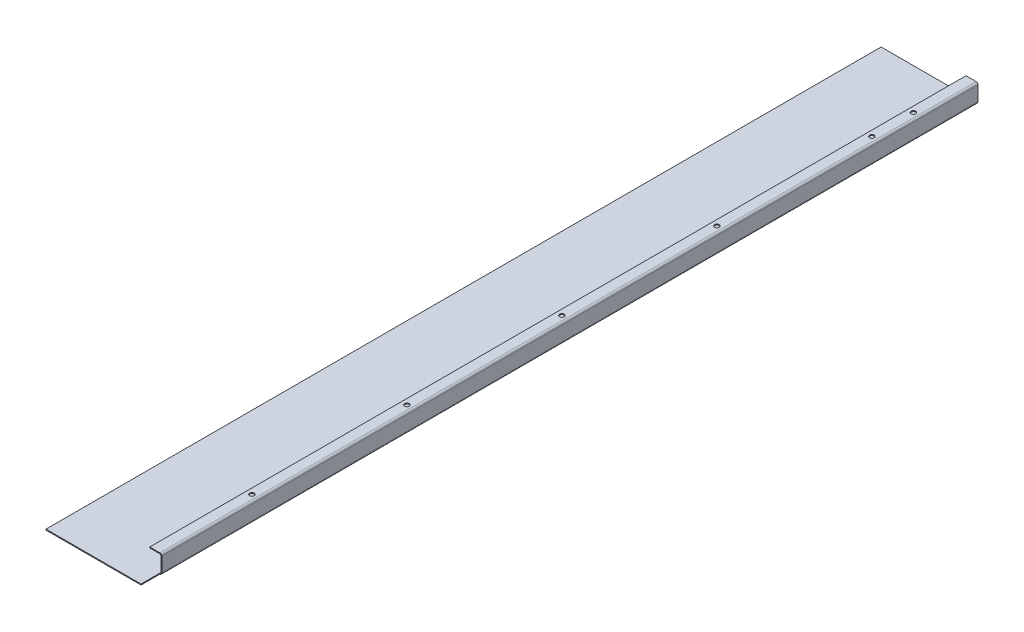
from build123d import *

# Parameters (mm, degrees)
SKETCH1_W                    = 105
SKETCH1_H                    = 905.2
BASE_FLANGE1_DEPTH           = 1
EDGE_FLANGE1_STRIP_W         = 6
EDGE_FLANGE1_STRIP_H         = 1
EDGE_FLANGE1_STRIP_CUT_DEPTH = 905.2
EDGE_FLANGE1_DEPTH           = 905.2
EDGE_FLANGE2_STRIP_W         = 6
EDGE_FLANGE2_STRIP_H         = 1
EDGE_FLANGE2_STRIP_CUT_DEPTH = 905.2
EDGE_FLANGE2_DEPTH           = 905.2
SKETCH19_R                   = 2.5
CUT_EXTRUDE2_DEPTH           = 10
CUT_EXTRUDE3_START           = -20.5
CUT_EXTRUDE3_DEPTH           = 20.5


# Read off the part's stored shape, not the designer's step: Cut-Extrude3
# Sheet-metal steps are written as plain solids
with BuildPart() as part:
    # Sketch1 → Base-Flange1 (new body)
    with BuildSketch(Plane(origin=(0, 0, 0), x_dir=(1, 0, 0), z_dir=(0, 1, 0))):
        with Locations((52.5, 452.6)):
            Rectangle(SKETCH1_W, SKETCH1_H)
    extrude(amount=-BASE_FLANGE1_DEPTH)

    # Edge-Flange1 strip (across the edge) → Edge-Flange1 strip cut (cut)
    with BuildSketch(Plane(origin=(105, 0, 0), x_dir=(-1, 0, 0), z_dir=(0, 0, -1))):
        with Locations((-1, -0.5)):
            Rectangle(EDGE_FLANGE1_STRIP_W, EDGE_FLANGE1_STRIP_H)
    extrude(amount=EDGE_FLANGE1_STRIP_CUT_DEPTH, mode=Mode.SUBTRACT)

    # Edge-Flange1 section (across the edge) → Edge-Flange1 (add)
    with BuildSketch(Plane(origin=(105, 0, 0), x_dir=(-1, 0, 0), z_dir=(0, 0, -1))):
        with BuildLine():
            Line((0, 1), (0, 19))
            Line((0, 19), (1, 19))
            Line((1, 19), (1, 1))
            ThreePointArc((1, 1), (1.292893219, 0.292893219), (2, 0))
            Line((2, 0), (2, -1))
            ThreePointArc((2, -1), (0.585786438, -0.414213562), (0, 1))
        make_face()
    extrude(amount=EDGE_FLANGE1_DEPTH)

    # Edge-Flange2 strip (across the edge) → Edge-Flange2 strip cut (cut)
    with BuildSketch(Plane(origin=(104, 19, 0), x_dir=(0, -1, 0), z_dir=(0, 0, -1))):
        with Locations((-1, -0.5)):
            Rectangle(EDGE_FLANGE2_STRIP_W, EDGE_FLANGE2_STRIP_H)
    extrude(amount=EDGE_FLANGE2_STRIP_CUT_DEPTH, mode=Mode.SUBTRACT)

    # Edge-Flange2 section (across the edge) → Edge-Flange2 (add)
    with BuildSketch(Plane(origin=(104, 19, 0), x_dir=(0, -1, 0), z_dir=(0, 0, -1))):
        with BuildLine():
            Line((0, 1), (0, 12))
            Line((0, 12), (1, 12))
            Line((1, 12), (1, 1))
            ThreePointArc((1, 1), (1.292893219, 0.292893219), (2, 0))
            Line((2, 0), (2, -1))
            ThreePointArc((2, -1), (0.585786438, -0.414213562), (0, 1))
        make_face()
    extrude(amount=EDGE_FLANGE2_DEPTH)

    # Sketch19 → Cut-Extrude2 (cut)
    with BuildSketch(Plane(origin=(0, 19, 0), x_dir=(1, 0, 0), z_dir=(0, 1, 0))):
        with Locations(Location((98, 842.2, 0), (0, 0, 180))):
            Circle(SKETCH19_R)
        with Locations(Location((98, 797.2, 0), (0, 0, 180))):
            Circle(SKETCH19_R)
        with Locations(Location((98, 629.2, 0), (0, 0, 180))):
            Circle(SKETCH19_R)
        with Locations(Location((98, 461.2, 0), (0, 0, 180))):
            Circle(SKETCH19_R)
        with Locations(Location((98, 293.2, 0), (0, 0, 180))):
            Circle(SKETCH19_R)
        with Locations(Location((98, 125.2, 0), (0, 0, 180))):
            Circle(SKETCH19_R)
    extrude(amount=-CUT_EXTRUDE2_DEPTH, mode=Mode.SUBTRACT)

    # Cut-Extrude3 outline → Cut-Extrude3 (cut)
    with BuildSketch(Plane.XY.offset(CUT_EXTRUDE3_START)):
        with BuildLine():
            ThreePointArc((104, 1), (103.707106781, 0.292893219), (103, 0))
            Line((103, 0), (103, -1))
            ThreePointArc((103, -1), (104.414213562, -0.414213562), (105, 1))
            Line((105, 1), (105, 17))
            ThreePointArc((105, 17), (104.414213562, 18.414213562), (103, 19))
            Line((103, 19), (92, 19))
            Line((92, 19), (92, 18))
            Line((92, 18), (103, 18))
            ThreePointArc((103, 18), (103.707106781, 17.707106781), (104, 17))
            Line((104, 17), (104, 1))
        make_face()
    extrude(amount=CUT_EXTRUDE3_DEPTH, mode=Mode.SUBTRACT)


solid = part.part
